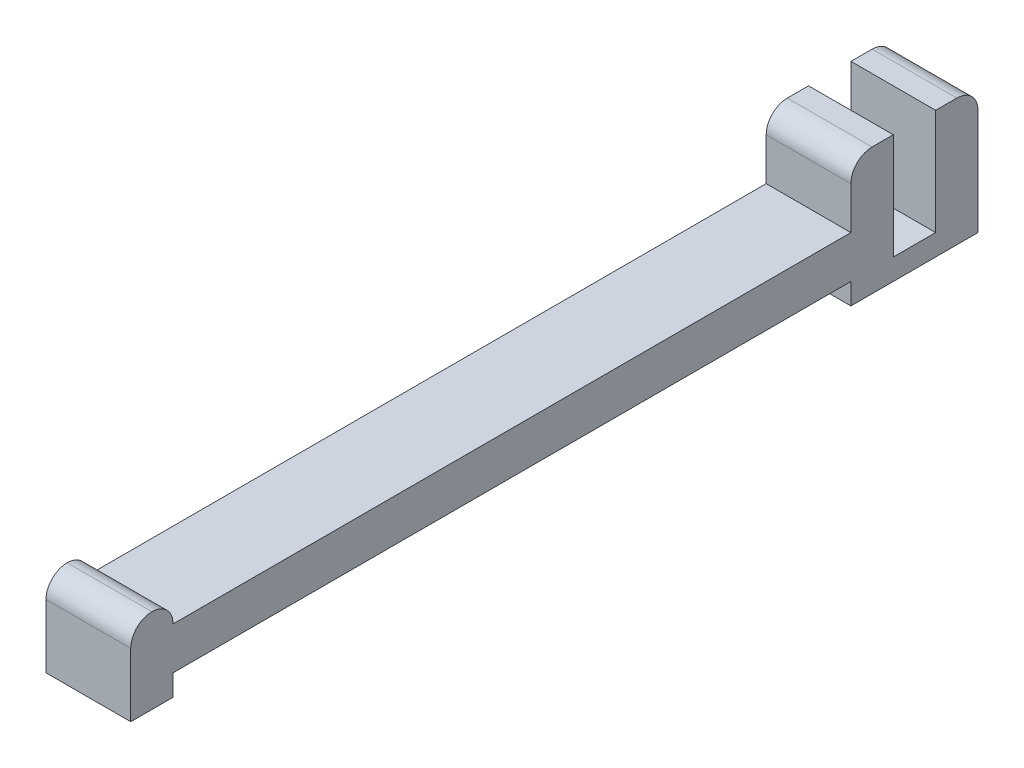
from build123d import *

# Parameters (mm, degrees)
BOSS_EXTRUDE1_DEPTH = 40
FILLET1_R           = 10
FILLET2_R           = 10


with BuildPart() as part:
    # Sketch2 → Boss-Extrude1 (new body)
    with BuildSketch(Plane(origin=(0, 0, 0), x_dir=(0, 0, -1), z_dir=(1, 0, 0))):
        Polygon((-160, 10), (-160, 20), (-180, 20), (-180, -20), (-160, -20), (-160, -10), (160, -10), (160, -20), (180, -20), (220, -20), (220, 40), (200, 40), (200, -10), (180, -10), (180, 40), (160, 40), (160, 10), align=None)
    extrude(amount=BOSS_EXTRUDE1_DEPTH)

    # Fillet1
    fillet1_edges = [part.edges().sort_by_distance(p)[0] for p in [
        (20, 20, 180),
        (20, 20, 160),
    ]]
    fillet(fillet1_edges, radius=FILLET1_R - 0.0001)  # a hair under: the kernel refuses the full size

    # Fillet2
    fillet2_edges = [part.edges().sort_by_distance(p)[0] for p in [
        (20, 40, -160),
        (20, 40, -220),
    ]]
    fillet(fillet2_edges, radius=FILLET2_R)


solid = part.part
